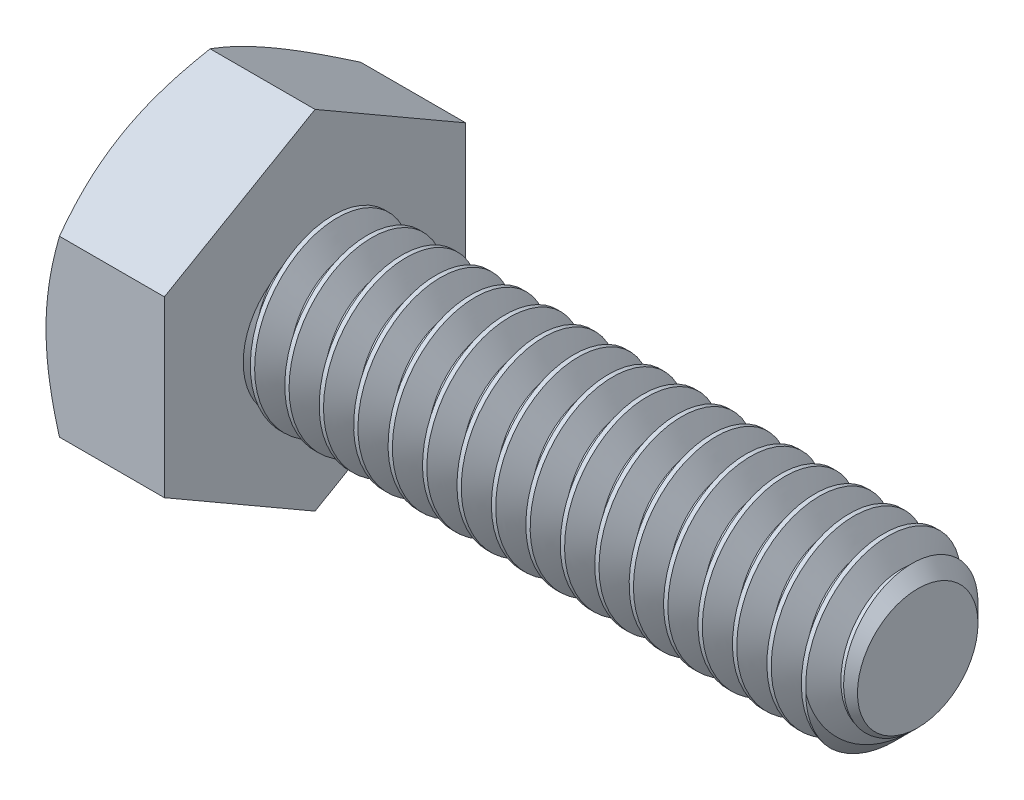
from build123d import *

# Parameters (mm, degrees)
SKETCH5_R           = 3.175
BOSS_EXTRUDE3_DEPTH = 22.225
CHAMFER1_SIZE       = 0.9525
CUT_SWEEP1_PITCH    = 1.27
BOSS_EXTRUDE4_DEPTH = 4.365625
SKETCH8_OUTSIDE_W   = 119.576
SKETCH8_OUTSIDE_H   = 121.296
SKETCH8_OUTSIDE_R   = 5.55625
CUT_EXTRUDE3_DEPTH  = 28.912287827
CUT_EXTRUDE3_DRAFT  = -60
CUT_EXTRUDE4_DEPTH  = 0.254
CIRPATTERN1_COUNT   = 6


with BuildPart() as part:
    # Sketch5 → Boss-Extrude3 (new body)
    with BuildSketch(Plane(origin=(13.2953125, 0, 0), x_dir=(0, 0, -1), z_dir=(1, 0, 0))):
        Circle(SKETCH5_R)
    extrude(amount=-BOSS_EXTRUDE3_DEPTH)

    # Chamfer1
    chamfer1_edges = [part.edges().sort_by_distance(p)[0] for p in [
        (13.2953125, 0, 3.175),
    ]]
    chamfer(chamfer1_edges, length=CHAMFER1_SIZE)

    # Cut-Sweep1: the profile of Sketch10 profile screwed along a right-hand helix of 18.5 turns, 8 arcs to a turn; built about Z, then put on its axis
    cut_sweep1_z = Axis((0, 0, 0), (0, 0, 1))
    cut_sweep1_corners = [(3.1753, 0, 0.000173205), (2.350110803, 0, -0.47625), (2.350110803, 0, -0.635), (3.1753, 0, -1.111423205)]
    with BuildLine(mode=Mode.PRIVATE) as cut_sweep1_profile:
        Line(cut_sweep1_corners[0], cut_sweep1_corners[1])
        Line(cut_sweep1_corners[1], cut_sweep1_corners[2])
        Line(cut_sweep1_corners[2], cut_sweep1_corners[3])
        Line(cut_sweep1_corners[3], cut_sweep1_corners[0])
    cut_sweep1_cap = Face(cut_sweep1_profile.wire())
    cut_sweep1_turn_angles = [0, 22.5, 45, 67.5, 90, 112.5, 135, 157.5, 180, 202.5, 225, 247.5, 270, 292.5, 315, 337.5, 360]
    cut_sweep1_turn_weights = [1, 0.9238795325112867, 1, 0.9238795325112867, 1, 0.9238795325112867, 1, 0.9238795325112867, 1, 0.9238795325112867, 1, 0.9238795325112867, 1, 0.9238795325112867, 1, 0.9238795325112867, 1]
    cut_sweep1_turn_rails = [Edge.make_bspline([Vector(p[0], p[1], 0).rotate(cut_sweep1_z, cut_sweep1_turn_angles[k]) / cut_sweep1_turn_weights[k] + Vector(0, 0, p[2] + CUT_SWEEP1_PITCH * cut_sweep1_turn_angles[k] / 360) for k in range(17)], [0, 0, 0, 1, 1, 2, 2, 3, 3, 4, 4, 5, 5, 6, 6, 7, 7, 8, 8, 8], 2, cut_sweep1_turn_weights) for p in cut_sweep1_corners]
    cut_sweep1_turn_sides = [Face.make_surface_from_curves(cut_sweep1_turn_rails[p[0]], cut_sweep1_turn_rails[p[1]]) for p in [(0, 1), (1, 2), (2, 3), (3, 0)]]
    cut_sweep1_last_angles = [6480, 6502.5, 6525, 6547.5, 6570, 6592.5, 6615, 6637.5, 6660]
    cut_sweep1_last_weights = [1, 0.9238795325112867, 1, 0.9238795325112867, 1, 0.9238795325112867, 1, 0.9238795325112139, 1]
    cut_sweep1_last_rails = [Edge.make_bspline([Vector(p[0], p[1], 0).rotate(cut_sweep1_z, cut_sweep1_last_angles[k]) / cut_sweep1_last_weights[k] + Vector(0, 0, p[2] + CUT_SWEEP1_PITCH * cut_sweep1_last_angles[k] / 360) for k in range(9)], [0, 0, 0, 1, 1, 2, 2, 3, 3, 4, 4, 4], 2, cut_sweep1_last_weights) for p in cut_sweep1_corners]
    cut_sweep1_last_sides = [Face.make_surface_from_curves(cut_sweep1_last_rails[p[0]], cut_sweep1_last_rails[p[1]]) for p in [(0, 1), (1, 2), (2, 3), (3, 0)]]
    cut_sweep1 = Plane(origin=(13.2953125, 0, 0), x_dir=(0, 1, 0), z_dir=(-1, 0, 0)) * Solid(Shell([*[p.moved(Location((0, 0, CUT_SWEEP1_PITCH * i))) for i in range(18) for p in cut_sweep1_turn_sides], *cut_sweep1_last_sides, cut_sweep1_cap, cut_sweep1_cap.rotate(cut_sweep1_z, 6660).moved(Location((0, 0, CUT_SWEEP1_PITCH * 6660 / 360)))]))
    add(cut_sweep1, mode=Mode.SUBTRACT)

    # Sketch6 → Boss-Extrude4 (add)
    with BuildSketch(Plane.ZY.offset(8.9296875)):
        Polygon((5.55625, 3.207902433), (0, 6.415804866), (-5.55625, 3.207902433), (-5.55625, -3.207902433), (0, -6.415804866), (5.55625, -3.207902433), align=None)
    extrude(amount=BOSS_EXTRUDE4_DEPTH)


with BuildPart() as cut_extrude3_tool:
    # Sketch8 outside → Cut-Extrude3 (with draft: the straight prism first)
    with BuildSketch(Plane.ZY.offset(13.2953125)):
        Rectangle(SKETCH8_OUTSIDE_W, SKETCH8_OUTSIDE_H)
        Circle(SKETCH8_OUTSIDE_R, mode=Mode.SUBTRACT)
    extrude(amount=-CUT_EXTRUDE3_DEPTH)
    # Cut-Extrude3: the draft: its side faces are tilted about the plane it starts from
    cut_extrude3_sides = [cut_extrude3_tool.faces().sort_by_distance(p)[0] for p in [
        (1.160831414, -60.648, 0),
        (1.160831414, 0, 59.788),
        (1.160831414, 60.648, 0),
        (1.160831414, 0, -59.788),
        (1.160831414, 0, -5.55625),
    ]]
    draft(cut_extrude3_sides, Plane.ZY.offset(13.2953125), CUT_EXTRUDE3_DRAFT)


with BuildPart() as part_1:
    add(part.part)

    # Cut-Extrude3: cut by cut_extrude3_tool
    add(cut_extrude3_tool.part, mode=Mode.SUBTRACT)

    # Sketch12 → Cut-Extrude4 (cut)
    with BuildSketch(Plane.ZY.offset(13.2953125)):
        with BuildLine():
            Line((0.1666875, 4.2783125), (0.1666875, 2.3891875))
            ThreePointArc((0.1666875, 2.3891875), (0, 2.2225), (-0.1666875, 2.3891875))
            Line((-0.1666875, 2.3891875), (-0.1666875, 4.2783125))
            ThreePointArc((-0.1666875, 4.2783125), (0, 4.445), (0.1666875, 4.2783125))
        make_face()
    cut_extrude4 = extrude(amount=-CUT_EXTRUDE4_DEPTH, mode=Mode.SUBTRACT)

    # CirPattern1: Cut-Extrude4 ×6 about axis
    cirpattern1_axis = Axis((0, 0, 0), (1, 0, 0))
    for i in range(1, CIRPATTERN1_COUNT):
        add(cut_extrude4.rotate(cirpattern1_axis, i * 360 / CIRPATTERN1_COUNT), mode=Mode.SUBTRACT)


solid = part_1.part
